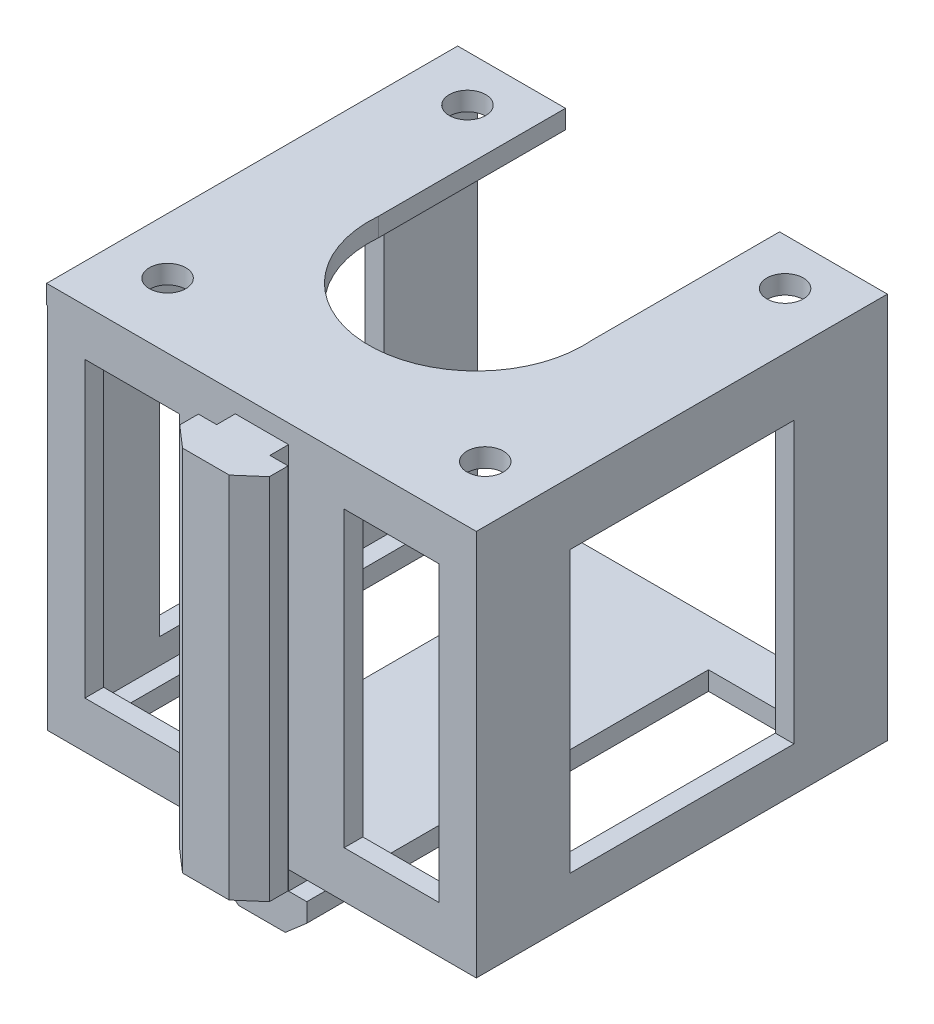
from build123d import *

# Parameters (mm, degrees)
BOSS_EXTRUDE1_DEPTH = 44
BOSS_EXTRUDE3_DEPTH = 6
SKETCH5_W           = 1.95
SKETCH5_H           = 2
CUT_EXTRUDE1_DEPTH  = 6
SKETCH6_W           = 1.95
SKETCH6_H           = 2
CUT_EXTRUDE2_DEPTH  = 6
CUT_EXTRUDE3_DEPTH  = 6
CUT_EXTRUDE4_DEPTH  = 6
BOSS_EXTRUDE4_DEPTH = 37.4
SKETCH11_W          = 2
SKETCH11_H          = 2
BOSS_EXTRUDE5_DEPTH = 44
SKETCH12_W          = 2
SKETCH12_H          = 2
BOSS_EXTRUDE6_DEPTH = 44
SKETCH13_W          = 42
SKETCH13_H          = 2
BOSS_EXTRUDE7_DEPTH = 44
SKETCH14_R          = 11.5
CUT_EXTRUDE5_DEPTH  = 2
SKETCH15_W          = 22.912878474
SKETCH15_H          = 22
CUT_EXTRUDE7_DEPTH  = 2
SKETCH16_R          = 1.95
CUT_EXTRUDE9_DEPTH  = 2
SKETCH18_W          = 24
SKETCH18_H          = 30
CUT_EXTRUDE11_DEPTH = 81.028557403
SKETCH19_W          = 10.25
SKETCH19_H          = 34
SKETCH19_W_2        = 10.15
CUT_EXTRUDE13_DEPTH = 2
SKETCH20_W          = 10.15
SKETCH20_H          = 31.4
CUT_EXTRUDE14_DEPTH = 2


with BuildPart() as part:
    # Sketch1 → Boss-Extrude1 (new body)
    with BuildSketch(Plane.XY):
        Polygon((-4.8, -1), (-2.85, -1), (-2.85, 1), (-22.95, 1), (-22.95, 3), (22.95, 3), (22.95, 1), (2.85, 1), (2.85, -1), (4.8, -1), (4.8, -3), (2.5, -5), (-2.5, -5), (-4.8, -3), align=None)
    extrude(amount=BOSS_EXTRUDE1_DEPTH)

    # Sketch3 → Boss-Extrude3 (add)
    with BuildSketch(Plane.XY.offset(44)):
        Polygon((-2.85, 1), (2.85, 1), (4.8, 1), (4.8, 3), (-4.8, 3), (-4.8, 1), align=None)
    extrude(amount=BOSS_EXTRUDE3_DEPTH)

    # Sketch5 → Cut-Extrude1 (cut)
    with BuildSketch(Plane(origin=(0, 3, 0), x_dir=(1, 0, 0), z_dir=(0, 1, 0))):
        with Locations((-3.825, -45)):
            Rectangle(SKETCH5_W, SKETCH5_H)
    extrude(amount=-CUT_EXTRUDE1_DEPTH, mode=Mode.SUBTRACT)

    # Sketch6 → Cut-Extrude2 (cut)
    with BuildSketch(Plane(origin=(0, 3, 0), x_dir=(1, 0, 0), z_dir=(0, 1, 0))):
        with Locations((3.825, -45)):
            Rectangle(SKETCH6_W, SKETCH6_H)
    extrude(amount=-CUT_EXTRUDE2_DEPTH, mode=Mode.SUBTRACT)

    # Sketch7 → Cut-Extrude3 (cut)
    with BuildSketch(Plane(origin=(0, 3, 0), x_dir=(1, 0, 0), z_dir=(0, 1, 0))):
        Polygon((4.8, -48), (2.5, -50), (4.8, -50), align=None)
    extrude(amount=-CUT_EXTRUDE3_DEPTH, mode=Mode.SUBTRACT)

    # Sketch8 → Cut-Extrude4 (cut)
    with BuildSketch(Plane(origin=(0, 3, 0), x_dir=(1, 0, 0), z_dir=(0, 1, 0))):
        Polygon((-2.5, -50), (-4.8, -48), (-4.8, -50), align=None)
    extrude(amount=-CUT_EXTRUDE4_DEPTH, mode=Mode.SUBTRACT)

    # Sketch9 → Boss-Extrude4 (add)
    with BuildSketch(Plane(origin=(0, 3, 0), x_dir=(1, 0, 0), z_dir=(0, 1, 0))):
        Polygon((-22.95, 0), (-20.95, 0), (-20.95, -42), (20.95, -42), (20.95, 0), (22.95, 0), (22.95, -44), (2.85, -44), (2.85, -46), (4.8, -46), (4.8, -48), (2.5, -50), (-2.5, -50), (-4.8, -48), (-4.8, -46), (-2.85, -46), (-2.85, -44), (-22.95, -44), align=None)
    extrude(amount=BOSS_EXTRUDE4_DEPTH)

    # Sketch11 → Boss-Extrude5 (add)
    with BuildSketch(Plane(origin=(0, 0, 0), x_dir=(-1, 0, 0), z_dir=(0, 0, -1))):
        with Locations((-21.95, 41.4)):
            Rectangle(SKETCH11_W, SKETCH11_H)
    extrude(amount=-BOSS_EXTRUDE5_DEPTH)

    # Sketch12 → Boss-Extrude6 (add)
    with BuildSketch(Plane.ZY.offset(-20.95)):
        with Locations((43, 41.4)):
            Rectangle(SKETCH12_W, SKETCH12_H)
    extrude(amount=BOSS_EXTRUDE6_DEPTH)

    # Sketch13 → Boss-Extrude7 (add)
    with BuildSketch(Plane.ZY.offset(-20.95)):
        with Locations((21, 41.4)):
            Rectangle(SKETCH13_W, SKETCH13_H)
    extrude(amount=BOSS_EXTRUDE7_DEPTH)

    # Sketch14 → Cut-Extrude5 (cut)
    with BuildSketch(Plane.XZ.offset(-40.4)):
        with Locations((-0.05, 21)):
            Circle(SKETCH14_R)
    extrude(amount=-CUT_EXTRUDE5_DEPTH, mode=Mode.SUBTRACT)

    # Sketch15 → Cut-Extrude7 (cut)
    with BuildSketch(Plane(origin=(0, 42.4, 0), x_dir=(1, 0, 0), z_dir=(0, 1, 0))):
        with Locations((-0.05, -11)):
            Rectangle(SKETCH15_W, SKETCH15_H)
    extrude(amount=-CUT_EXTRUDE7_DEPTH, mode=Mode.SUBTRACT)

    # Sketch16 → Cut-Extrude9 (cut)
    with BuildSketch(Plane(origin=(0, 42.4, 0), x_dir=(1, 0, 0), z_dir=(0, 1, 0))):
        with Locations((-17.05, -4.95)):
            Circle(SKETCH16_R)
        with Locations((16.95, -4.95)):
            Circle(SKETCH16_R)
        with Locations((-17.05, -37.05)):
            Circle(SKETCH16_R)
        with Locations((16.95, -37.05)):
            Circle(SKETCH16_R)
    extrude(amount=-CUT_EXTRUDE9_DEPTH, mode=Mode.SUBTRACT)

    # Sketch18 → Cut-Extrude11 (cut, through all)
    with BuildSketch(Plane.ZY.offset(22.95)):
        with Locations((22, 20.7)):
            Rectangle(SKETCH18_W, SKETCH18_H)
    extrude(amount=-CUT_EXTRUDE11_DEPTH, mode=Mode.SUBTRACT)

    # Sketch19 → Cut-Extrude13 (cut)
    with BuildSketch(Plane.XZ.offset(-1)):
        with Locations((-13.925, 22)):
            Rectangle(SKETCH19_W, SKETCH19_H)
        with Locations((13.875, 22)):
            Rectangle(SKETCH19_W_2, SKETCH19_H)
    extrude(amount=-CUT_EXTRUDE13_DEPTH, mode=Mode.SUBTRACT)

    # Sketch20 → Cut-Extrude14 (cut)
    with BuildSketch(Plane.XY.offset(44)):
        with Locations((-13.875, 21.7)):
            Rectangle(SKETCH20_W, SKETCH20_H)
        with Locations((13.875, 21.7)):
            Rectangle(SKETCH20_W, SKETCH20_H)
    extrude(amount=-CUT_EXTRUDE14_DEPTH, mode=Mode.SUBTRACT)


solid = part.part
